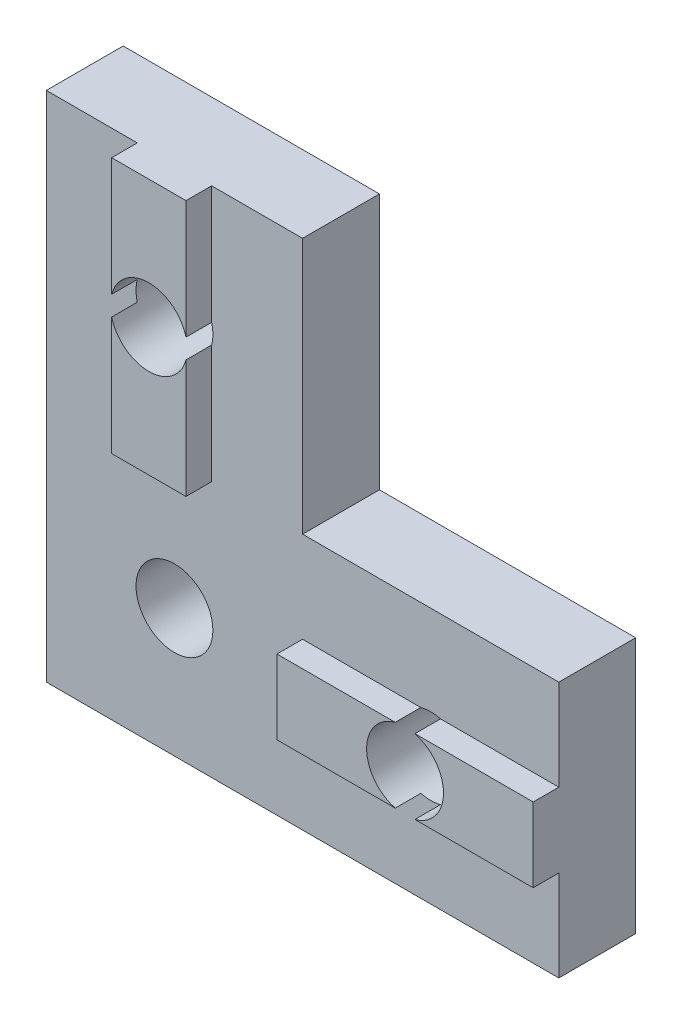
from build123d import *

# Parameters (mm, degrees)
BOSS_EXTRU_1_DEPTH      = 3
ESQUISSE2_W             = 2.9
ESQUISSE2_H             = 10
ESQUISSE2_W_2           = 10
ESQUISSE2_H_2           = 2.9
BOSS_EXTRU_2_DEPTH      = 1
ESQUISSE4_R             = 1.5
ENL_V_MAT_EXTRU_2_DEPTH = 29.565713714


with BuildPart() as part:
    # Esquisse1 → Boss.-Extru.1 (new body)
    with BuildSketch(Plane.XY):
        Polygon((0, 0), (20, 0), (20, 10), (10, 10), (10, 20), (0, 20), align=None)
    extrude(amount=BOSS_EXTRU_1_DEPTH)

    # Esquisse2 → Boss.-Extru.2 (add)
    with BuildSketch(Plane.XY.offset(3)):
        with Locations((5, 15)):
            Rectangle(ESQUISSE2_W, ESQUISSE2_H)
        with Locations((15, 5)):
            Rectangle(ESQUISSE2_W_2, ESQUISSE2_H_2)
    extrude(amount=BOSS_EXTRU_2_DEPTH)

    # Esquisse4 → Enlèv. mat.-Extru.2 (cut, through all)
    with BuildSketch(Plane.XY.offset(4)):
        with Locations((5, 15)):
            Circle(ESQUISSE4_R)
        with Locations((5, 5)):
            Circle(ESQUISSE4_R)
        with Locations((15, 5)):
            Circle(ESQUISSE4_R)
    extrude(amount=-ENL_V_MAT_EXTRU_2_DEPTH, mode=Mode.SUBTRACT)


solid = part.part
